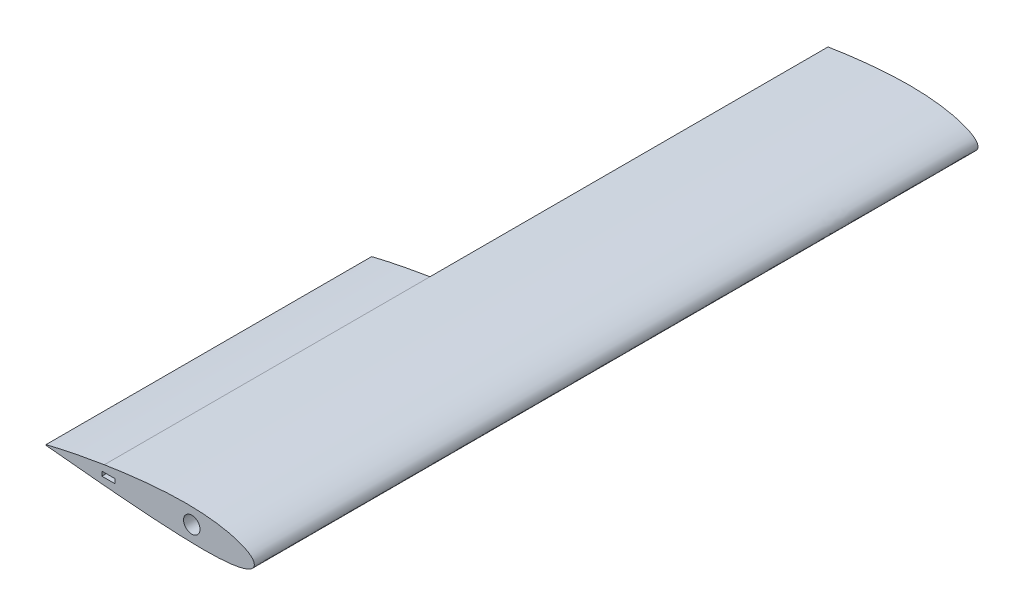
from build123d import *

# Parameters (mm, degrees)
BOSS_EXTRUDE1_DEPTH = 1120
BOSS_EXTRUDE2_DEPTH = 504
SKETCH3_R           = 12.7
CUT_EXTRUDE1_DEPTH  = 801
SKETCH4_W           = 32
SKETCH4_H           = 40.882
CUT_EXTRUDE2_DEPTH  = 46
SKETCH5_W           = 60
SKETCH5_H           = 12
CUT_EXTRUDE3_DEPTH  = 46
SKETCH6_W           = 54
SKETCH6_H           = 29.1
CUT_EXTRUDE4_DEPTH  = 64
SKETCH7_W           = 20.4
SKETCH7_H           = 6.8
CUT_EXTRUDE5_DEPTH  = 26
SKETCH8_W           = 20
SKETCH8_H           = 4
CUT_EXTRUDE6_DEPTH  = 20


with BuildPart() as part:
    # Sketch1 → Boss-Extrude1 (new body)
    with BuildSketch(Plane.XY):
        with BuildLine():
            Line((-232.07976, 18.640331755), (-232.07976, -9.299539429))
            add(Edge.make_bspline(
                [(-232.07976, 18.640331755), (-229.164273263, 19.105137392), (-222.291133752, 20.200897474), (-211.337542784, 21.800276655), (-199.146674743, 23.458907068), (-186.709533826, 24.99775787), (-174.104063941, 26.396384265), (-161.408619673, 27.628181699), (-148.702826871, 28.669998803), (-136.048616227, 29.498668375), (-123.502304929, 30.100378699), (-111.141296499, 30.381034684), (-99.066442851, 30.337763188), (-87.381824011, 29.96392256), (-76.165988678, 29.262541202), (-65.494170353, 28.242118376), (-55.437562328, 26.917551706), (-46.062520993, 25.309550624), (-37.429846456, 23.444065126), (-29.594109363, 21.3513396), (-22.603015821, 19.064676337), (-16.496733591, 16.618893003), (-11.307130205, 14.048195179), (-7.056738632, 11.383320116), (-3.758682454, 8.645345207), (-1.421067217, 5.837729222), (-0.076519927, 2.93397469), (0.175352503, -0.017611891), (-0.655158047, -2.858555013), (-2.530689177, -5.439611815), (-5.336827593, -7.743904666), (-9.03994776, -9.814562437), (-13.624875961, -11.664753347), (-19.070291538, -13.294987869), (-25.346462309, -14.70103051), (-32.416774291, -15.879078453), (-40.239338685, -16.827563542), (-48.768060709, -17.548259209), (-57.953346605, -18.046825288), (-67.742561923, -18.333070043), (-78.080327008, -18.420905027), (-88.908707336, -18.328114372), (-100.167316867, -18.075575791), (-111.793460515, -17.687481617), (-123.745328455, -17.185705506), (-135.973510615, -16.604056476), (-148.402819763, -15.890368868), (-160.93563744, -15.074548453), (-173.478390843, -14.17792148), (-185.955186825, -13.221857076), (-198.290086365, -12.225761595), (-210.407470499, -11.20618891), (-221.646872664, -10.232436467), (-228.837861155, -9.589426373), (-232.07976, -9.299539429)],
                knots=[0, 0, 0, 0, 0.018424224, 0.043434346, 0.069080412, 0.095203092, 0.121640117, 0.148227444, 0.17480049, 0.201195447, 0.227363977, 0.253181792, 0.278347264, 0.302710399, 0.326128333, 0.348466602, 0.369600377, 0.389415723, 0.407811011, 0.424698681, 0.44000774, 0.453687637, 0.465714725, 0.476103672, 0.484928355, 0.492360154, 0.498730164, 0.504586951, 0.510443348, 0.516803825, 0.524198712, 0.532940661, 0.543185695, 0.554995644, 0.568376342, 0.583298542, 0.599709376, 0.617538825, 0.636703502, 0.65710892, 0.678650912, 0.701216586, 0.724685048, 0.748928058, 0.7738107, 0.799337901, 0.825325561, 0.851504471, 0.877716004, 0.903800001, 0.929595993, 0.954944401, 0.979687675, 1, 1, 1, 1], degree=3))
        make_face()
    extrude(amount=-BOSS_EXTRUDE1_DEPTH)

    # Sketch2 → Boss-Extrude2 (add)
    with BuildSketch(Plane.XY):
        with BuildLine():
            Line((-232.07976, 18.640331755), (-232.07976, -9.299539429))
            add(Edge.make_bspline(
                [(-232.07976, -9.299539429), (-232.665749528, -9.247457079), (-236.934557579, -8.868048329), (-244.715948926, -8.155780655), (-255.233547628, -7.182675415), (-265.178963193, -6.244796096), (-274.489444659, -5.35296602), (-283.105666868, -4.514522896), (-290.972478934, -3.737169374), (-298.039247191, -3.028597089), (-304.260184667, -2.39533485), (-309.594932862, -1.846814612), (-314.008232694, -1.38276071), (-317.472079994, -1.027677658), (-319.961203892, -0.741044399), (-321.464120443, -0.620061141), (-322.14198951, -0.505870173), (-322.321741193, -0.506509982), (-322.333, -0.506550056)],
                knots=[0, 0, 0, 0, 0.019462551, 0.14178051, 0.258505433, 0.368899529, 0.472261554, 0.567931303, 0.655293986, 0.733784513, 0.802891701, 0.862162346, 0.911205133, 0.949694244, 0.977372582, 0.994054454, 0.999627599, 1, 1, 1, 1], degree=3))
            Line((-322.333, -0.506550056), (-322.333, 0.514797488))
            add(Edge.make_bspline(
                [(-232.07976, 18.640331755), (-232.997104276, 18.496640375), (-237.59945591, 17.775735177), (-245.697898879, 16.398726282), (-256.18174484, 14.549633525), (-266.070518156, 12.708392515), (-275.306517101, 10.911856103), (-283.834257123, 9.183893288), (-291.603294753, 7.551136168), (-298.567863892, 6.038773121), (-304.687234469, 4.671058189), (-309.925850109, 3.470601356), (-314.253461721, 2.457844833), (-317.645235976, 1.650544318), (-320.081782459, 1.063070488), (-321.538022536, 0.709024901), (-322.180548986, 0.552044036), (-322.333, 0.514797488)],
                knots=[0, 0, 0, 0, 0.030251696, 0.151773928, 0.267626296, 0.377089872, 0.479484952, 0.574174897, 0.660569789, 0.738129949, 0.806369318, 0.864858701, 0.913228834, 0.951173208, 0.978450569, 0.994887008, 1, 1, 1, 1], degree=3))
        make_face()
    extrude(amount=-BOSS_EXTRUDE2_DEPTH)

    # Sketch3 → Cut-Extrude1 (cut)
    with BuildSketch(Plane.XY):
        with Locations((-96.7, 6.044)):
            Circle(SKETCH3_R)
    extrude(amount=-CUT_EXTRUDE1_DEPTH, mode=Mode.SUBTRACT)

    # Sketch4 → Cut-Extrude2 (cut)
    with BuildSketch(Plane.XY.offset(-376.7)):
        with Locations((-96.7, 1.303)):
            Rectangle(SKETCH4_W, SKETCH4_H)
    extrude(amount=CUT_EXTRUDE2_DEPTH, mode=Mode.SUBTRACT)

    # Sketch5 → Cut-Extrude3 (cut)
    with BuildSketch(Plane.XY.offset(-376.7)):
        with Locations((-257.8664, -2.987)):
            Rectangle(SKETCH5_W, SKETCH5_H)
    extrude(amount=CUT_EXTRUDE3_DEPTH, mode=Mode.SUBTRACT)

    # Sketch6 → Cut-Extrude4 (cut)
    with BuildSketch(Plane.XY.offset(-598.5)):
        with Locations((-177.283, -2.36)):
            Rectangle(SKETCH6_W, SKETCH6_H)
    extrude(amount=CUT_EXTRUDE4_DEPTH, mode=Mode.SUBTRACT)

    # Sketch7 → Cut-Extrude5 (cut)
    with BuildSketch(Plane.XY.offset(-25.5)):
        with Locations((-225.633, 4.835)):
            Rectangle(SKETCH7_W, SKETCH7_H)
    extrude(amount=CUT_EXTRUDE5_DEPTH, mode=Mode.SUBTRACT)

    # Sketch8 → Cut-Extrude6 (cut)
    with BuildSketch(Plane.XY.offset(-930)):
        with Locations((-50, -17.343)):
            Rectangle(SKETCH8_W, SKETCH8_H)
    extrude(amount=CUT_EXTRUDE6_DEPTH, mode=Mode.SUBTRACT)


solid = part.part
